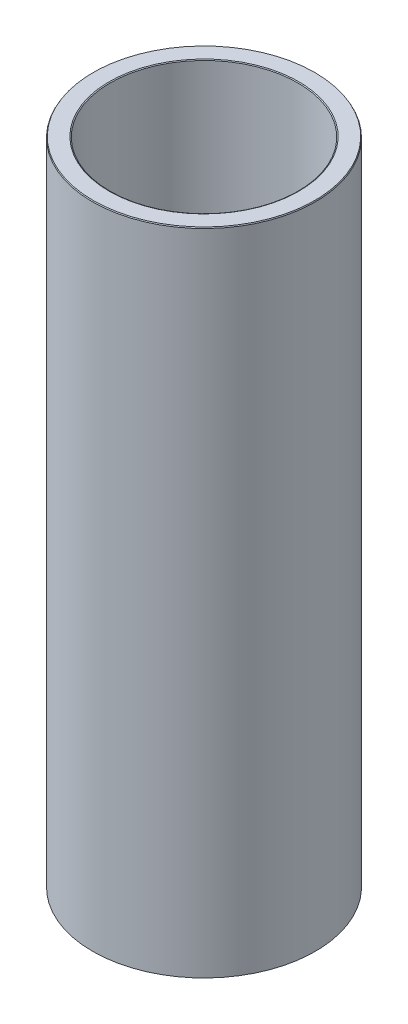
from build123d import *
from OCP.BRepFilletAPI import BRepFilletAPI_MakeChamfer

# Parameters (mm, degrees)
SKETCH1_R           = 47.5
BOSS_EXTRUDE1_DEPTH = 277.417146859
SKETCH2_R           = 40.037205731
CUT_EXTRUDE1_DEPTH  = 286.434359129
CHAMFER1_SIZE       = 0.412704239
CHAMFER1_SIZE2      = 0.238274903


with BuildPart() as part:
    # Sketch1 → Boss-Extrude1 (new body)
    with BuildSketch(Plane(origin=(0, 0, 0), x_dir=(1, 0, 0), z_dir=(0, 1, 0))):
        Circle(SKETCH1_R)
    extrude(amount=BOSS_EXTRUDE1_DEPTH)

    # Sketch2 → Cut-Extrude1 (cut, through all)
    with BuildSketch(Plane(origin=(0, 0, 0), x_dir=(1, 0, 0), z_dir=(0, 1, 0))):
        Circle(SKETCH2_R)
    extrude(amount=CUT_EXTRUDE1_DEPTH, mode=Mode.SUBTRACT)

    # Chamfer1: one chamfer whose edges measure the first distance from different faces: ONE call of the kernel's chamfer builder (chamfer() names one face for all edges)
    chamfer1_edges_1 = [part.edges().sort_by_distance(p)[0] for p in [
        (-40.037205731, 277.417146859, 0),
    ]]
    chamfer1_side_1 = [part.faces().sort_by_distance(p)[0] for p in [
        (-46.156497116, 277.417146859, 0),
    ]]
    chamfer1_edges_2 = [part.edges().sort_by_distance(p)[0] for p in [
        (-40.037205731, 0, 0),
    ]]
    chamfer1_side_2 = [part.faces().sort_by_distance(p)[0] for p in [
        (-40.037205731, 138.70857343, 0),
    ]]
    chamfer1_edges_3 = [part.edges().sort_by_distance(p)[0] for p in [
        (-47.5, 0, 0),
    ]]
    chamfer1_side_3 = [part.faces().sort_by_distance(p)[0] for p in [
        (-46.156497116, 0, 0),
    ]]
    chamfer1_edges_4 = [part.edges().sort_by_distance(p)[0] for p in [
        (-47.5, 277.417146859, 0),
    ]]
    chamfer1_side_4 = [part.faces().sort_by_distance(p)[0] for p in [
        (-47.5, 138.70857343, 0),
    ]]
    chamfer1 = BRepFilletAPI_MakeChamfer(part.part.solid().wrapped)
    for e in chamfer1_edges_1:
        chamfer1.Add(CHAMFER1_SIZE, CHAMFER1_SIZE2, e.wrapped, chamfer1_side_1[0].wrapped)  # the first distance lies on this face
    for e in chamfer1_edges_2:
        chamfer1.Add(CHAMFER1_SIZE, CHAMFER1_SIZE2, e.wrapped, chamfer1_side_2[0].wrapped)  # the first distance lies on this face
    for e in chamfer1_edges_3:
        chamfer1.Add(CHAMFER1_SIZE, CHAMFER1_SIZE2, e.wrapped, chamfer1_side_3[0].wrapped)  # the first distance lies on this face
    for e in chamfer1_edges_4:
        chamfer1.Add(CHAMFER1_SIZE, CHAMFER1_SIZE2, e.wrapped, chamfer1_side_4[0].wrapped)  # the first distance lies on this face
    add(Compound.cast(chamfer1.Shape()), mode=Mode.REPLACE)


solid = part.part
